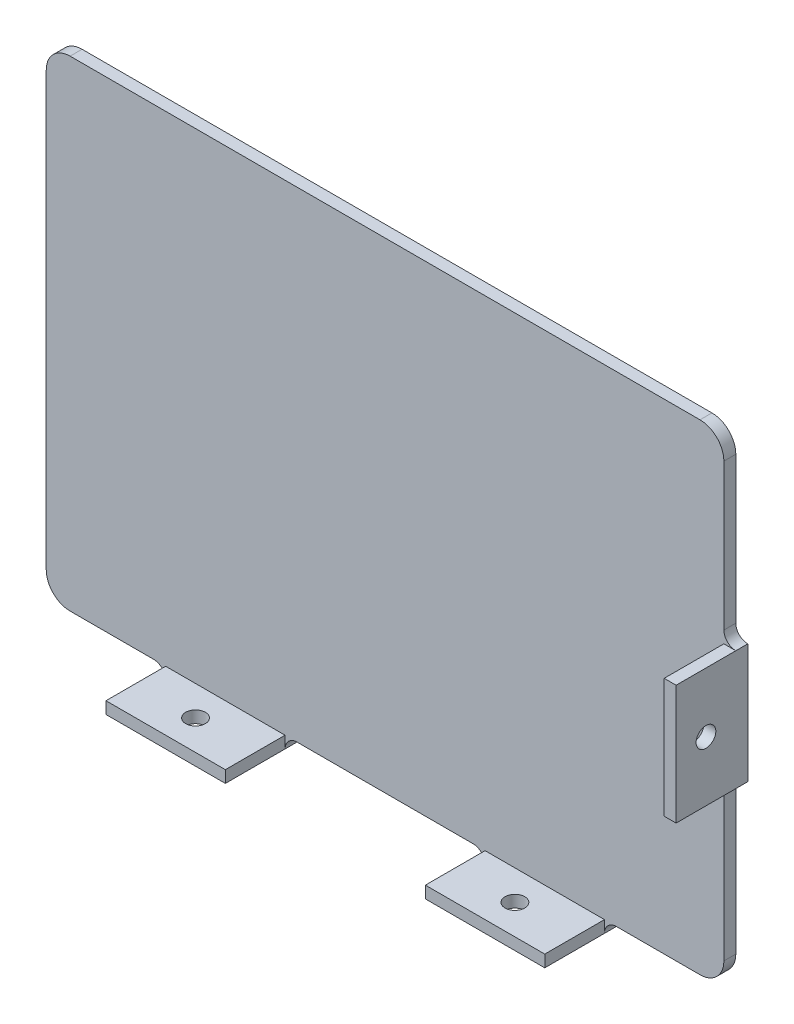
from build123d import *

# Parameters (mm, degrees)
EXTRUDE_1_DEPTH      = 2
EXTRUDE_2_DEPTH      = 10
EXTRUDE_2_DEPTH_BACK = 2
SKETCH_2_W           = 2
SKETCH_2_H           = 20
SKETCH_2_W_2         = 20
SKETCH_2_H_2         = 2
SKETCH_3_R           = 1.65
CUT_EXTRUDE_1_DEPTH  = 12
SKETCH_4_R           = 1.65
CUT_EXTRUDE_2_DEPTH  = 12
FILLET_1_R           = 2


with BuildPart() as part:
    # 草图1 → 凸台-拉伸1 (new body)
    with BuildSketch(Plane.XY):
        with BuildLine():
            Line((4, 0), (109.5, 0))
            ThreePointArc((109.5, 0), (112.328427125, 1.171572875), (113.5, 4))
            Line((113.5, 4), (113.5, 76.5))
            ThreePointArc((113.5, 76.5), (112.328427125, 79.328427125), (109.5, 80.5))
            Line((109.5, 80.5), (4, 80.5))
            ThreePointArc((4, 80.5), (1.171572875, 79.328427125), (0, 76.5))
            Line((0, 76.5), (0, 4))
            ThreePointArc((0, 4), (1.171572875, 1.171572875), (4, 0))
        make_face()
    extrude(amount=EXTRUDE_1_DEPTH)

    # 草图2 → 凸台-拉伸2 (add, two sides: drawn at the far end of the back side and taken through both)
    with BuildSketch(Plane.XY.offset(2).offset(-EXTRUDE_2_DEPTH_BACK)):
        with Locations((114.5, 40)):
            Rectangle(SKETCH_2_W, SKETCH_2_H)
        with Locations((30, -1)):
            Rectangle(SKETCH_2_W_2, SKETCH_2_H_2)
        with Locations((83.5, -1)):
            Rectangle(SKETCH_2_W_2, SKETCH_2_H_2)
    extrude(amount=EXTRUDE_2_DEPTH + EXTRUDE_2_DEPTH_BACK)

    # 草图3 → 切除-拉伸1 (cut)
    with BuildSketch(Plane(origin=(115.5, 0, 0), x_dir=(0, 0, -1), z_dir=(1, 0, 0))):
        with Locations((-7, 40)):
            Circle(SKETCH_3_R)
    extrude(amount=-CUT_EXTRUDE_1_DEPTH, mode=Mode.SUBTRACT)

    # 草图4 → 切除-拉伸2 (cut)
    with BuildSketch(Plane(origin=(0, -2, 0), x_dir=(-1, 0, 0), z_dir=(0, -1, 0))):
        with Locations(Location((-83.5, -7, 0), (0, 0, 180))):
            Circle(SKETCH_4_R)
        with Locations(Location((-30, -7, 0), (0, 0, 180))):
            Circle(SKETCH_4_R)
    extrude(amount=-CUT_EXTRUDE_2_DEPTH, mode=Mode.SUBTRACT)

    # 圆角1
    fillet_1_edges = [part.edges().sort_by_distance(p)[0] for p in [
        (113.5, 50, 1),
        (113.5, 30, 1),
        (40, 0, 1),
        (20, 0, 1),
        (73.5, 0, 1),
        (93.5, 0, 1),
    ]]
    fillet(fillet_1_edges, radius=FILLET_1_R - 0.0001)  # a hair under: the kernel refuses the full size


solid = part.part
